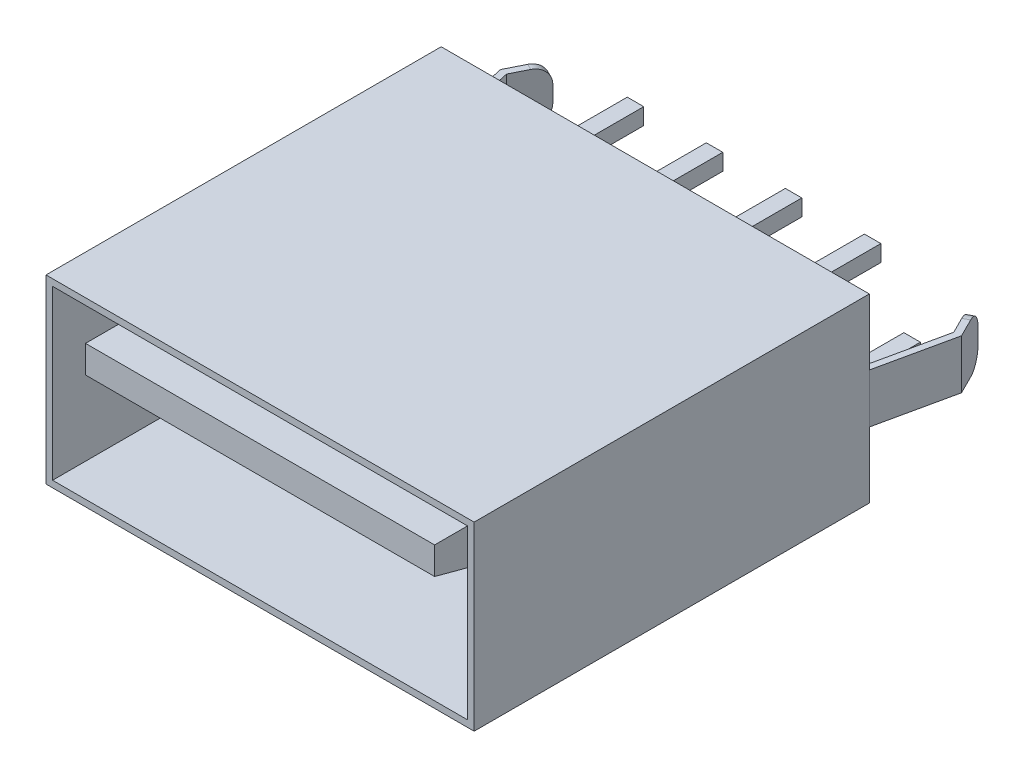
from build123d import *

# Parameters (mm, degrees)
SKETCH_1_W          = 13
SKETCH_1_H          = 5.5
EXTRUDE_1_DEPTH     = 12
SKETCH_2_W          = 12.6
SKETCH_2_H          = 5.1
CUT_EXTRUDE_1_DEPTH = 10
SKETCH_5_W          = 10.6
SKETCH_5_H          = 1.1
EXTRUDE_3_DEPTH     = 10
CHAMFER_1_SIZE      = 1
CHAMFER_1_SIZE2     = 0.267949192
SKETCH_13_W         = 0.5
SKETCH_13_H         = 0.5
EXTRUDE_7_DEPTH     = 3
THICKEN_START       = -0.75
THICKEN_1_DEPTH     = 1.5
THICKEN_2_DEPTH     = 1.5
FILLET_2_R          = 0.5


# Read off the part's stored shape, not the designer's step: 加厚1, 加厚2
with BuildPart() as part:
    # 草图1 → 凸台-拉伸1 (new body)
    with BuildSketch(Plane.XY):
        Rectangle(SKETCH_1_W, SKETCH_1_H)
    extrude(amount=EXTRUDE_1_DEPTH)

    # 草图2 → 切除-拉伸1 (cut)
    with BuildSketch(Plane.XY.offset(12)):
        Rectangle(SKETCH_2_W, SKETCH_2_H)
    extrude(amount=-CUT_EXTRUDE_1_DEPTH, mode=Mode.SUBTRACT)

    # 草图5 → 凸台-拉伸3 (add)
    with BuildSketch(Plane.XY.offset(2)):
        with Locations((0, 1)):
            Rectangle(SKETCH_5_W, SKETCH_5_H)
    extrude(amount=EXTRUDE_3_DEPTH)

    # 倒角1
    chamfer_1_edges = [part.edges().sort_by_distance(p)[0] for p in [
        (0, 0.45, 12),
    ]]
    chamfer_1_side = [part.faces().sort_by_distance(p)[0] for p in [
        (0, 0.45, 7),
    ]]
    chamfer(chamfer_1_edges, length=CHAMFER_1_SIZE, length2=CHAMFER_1_SIZE2, reference=chamfer_1_side[0])

    # 草图13 → 凸台-拉伸7 (add)
    with BuildSketch(Plane(origin=(0, 0, 0), x_dir=(-1, 0, 0), z_dir=(0, 0, -1))):
        with Locations((-3.6, 1)):
            Rectangle(SKETCH_13_W, SKETCH_13_H)
        with Locations((-1.2, 1)):
            Rectangle(SKETCH_13_W, SKETCH_13_H)
        with Locations((1.2, 1)):
            Rectangle(SKETCH_13_W, SKETCH_13_H)
        with Locations((3.6, 1)):
            Rectangle(SKETCH_13_W, SKETCH_13_H)
        with Locations((-2.4, -0.993127881)):
            Rectangle(SKETCH_13_W, SKETCH_13_H)
        with Locations((-4.8, -0.993127881)):
            Rectangle(SKETCH_13_W, SKETCH_13_H)
        with Locations((0, -0.993127881)):
            Rectangle(SKETCH_13_W, SKETCH_13_H)
        with Locations((2.4, -0.993127881)):
            Rectangle(SKETCH_13_W, SKETCH_13_H)
        with Locations((4.8, -0.993127881)):
            Rectangle(SKETCH_13_W, SKETCH_13_H)
    extrude(amount=EXTRUDE_7_DEPTH)

    # 加厚1 outline → 加厚1 (add)
    with BuildSketch(Plane(origin=(0, 0, 0), x_dir=(1, 0, 0), z_dir=(0, 1, 0)).offset(THICKEN_START)):
        Polygon((6.78959064, 2.273605125), (6.295328656, 0), (6.5, 0), (7, 2.3), (6.5, 3.3), (6.321114562, 3.210557281), align=None)
    extrude(amount=THICKEN_1_DEPTH)

    # 加厚2 outline → 加厚2 (add)
    with BuildSketch(Plane(origin=(0, 0, 0), x_dir=(1, 0, 0), z_dir=(0, 1, 0)).offset(THICKEN_START)):
        Polygon((-6.5, 0), (-6.295328656, 0), (-6.78959064, 2.273605125), (-6.321114562, 3.210557281), (-6.5, 3.3), (-7, 2.3), align=None)
    extrude(amount=THICKEN_2_DEPTH)

    # 圆角2
    fillet_2_edges = [part.edges().sort_by_distance(p)[0] for p in [
        (6.410557281, -0.75, -3.25527864),
        (6.410557281, 0.75, -3.25527864),
        (-6.410557281, -0.75, -3.25527864),
        (-6.410557281, 0.75, -3.25527864),
    ]]
    fillet(fillet_2_edges, radius=FILLET_2_R)


solid = part.part
